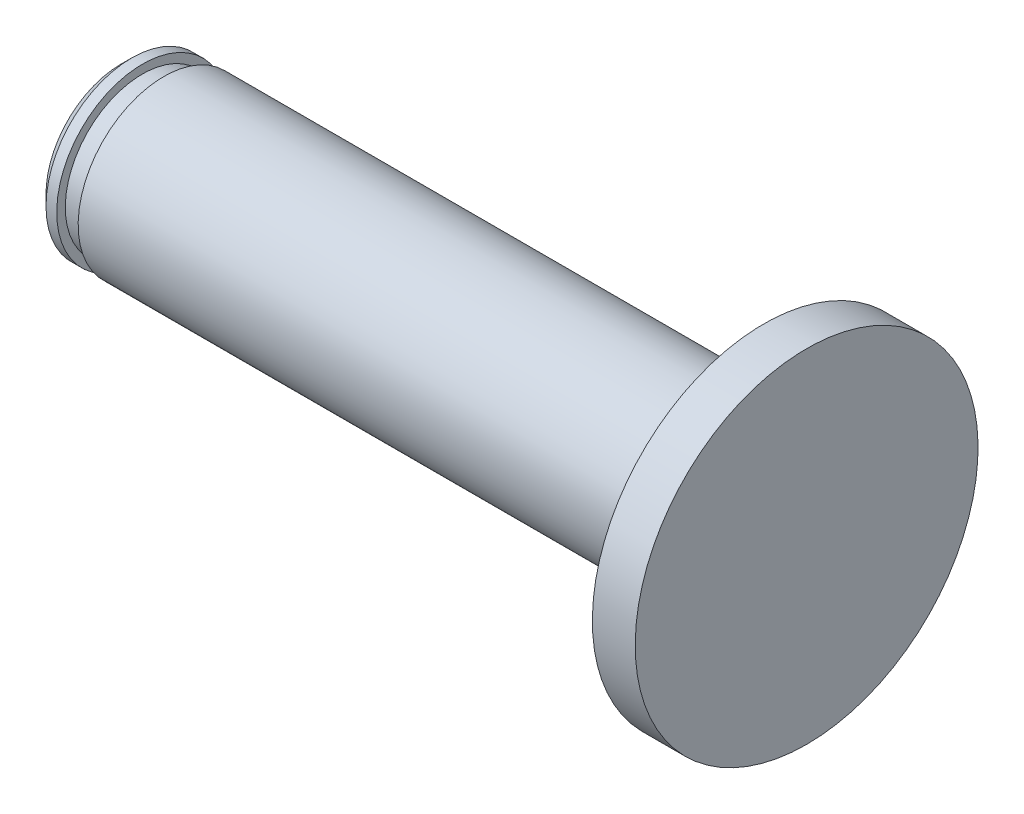
from build123d import *

# Parameters (mm, degrees)
CHAMFER_1_SIZE = 0.5


with BuildPart() as part:
    # Эскиз1 → Повернуть1 (revolve)
    with BuildSketch(Plane.XY):
        Polygon((0, 0), (-32, 0), (-32, 4), (-31, 4), (-31, 3.6), (-30, 3.6), (-30, 4), (-2, 4), (-2, 8), (0, 8), align=None)
    revolve(axis=Axis((-32, 0, 0), (1, 0, 0)))

    # Фаска1
    chamfer_1_edges = [part.edges().sort_by_distance(p)[0] for p in [
        (-32, -4, 0),
    ]]
    chamfer(chamfer_1_edges, length=CHAMFER_1_SIZE)


solid = part.part
